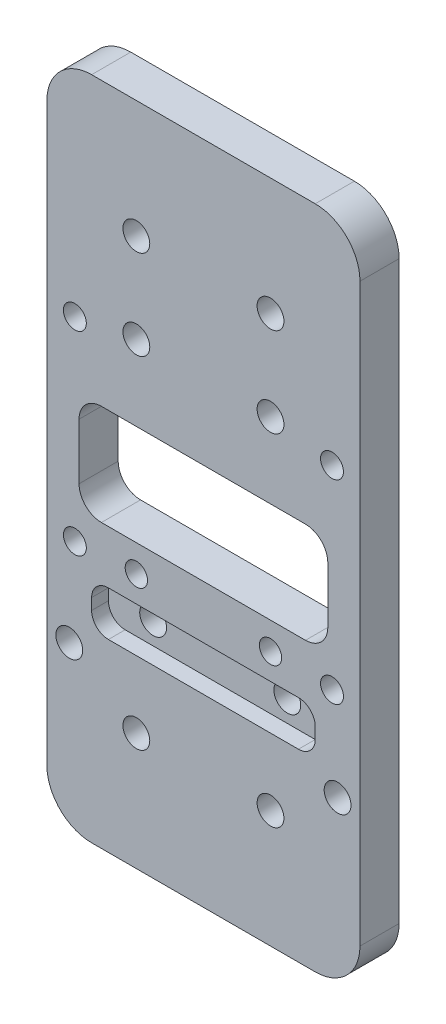
from build123d import *

# Parameters (mm, degrees)
BOSS_EXTRU_1_DEPTH      = 3.5
ESQUISSE2_R             = 1.2
ESQUISSE2_R_2           = 1.025
ENL_V_MAT_EXTRU_1_DEPTH = 66.852107028
ENL_V_MAT_EXTRU_2_DEPTH = 66.852107028
ESQUISSE7_R             = 1
ENL_V_MAT_EXTRU_4_DEPTH = 66.852107028
ESQUISSE9_R             = 1.2
ENL_V_MAT_EXTRU_6_DEPTH = 66.852107028
ENL_V_MAT_EXTRU_7_DEPTH = 1.5


with BuildPart() as part:
    # Esquisse1 → Boss.-Extru.1 (new body)
    with BuildSketch(Plane.XY):
        with BuildLine():
            Line((4, 0), (24, 0))
            ThreePointArc((24, 0), (26.828427125, 1.171572875), (28, 4))
            Line((28, 4), (28, 55.5))
            ThreePointArc((28, 55.5), (26.828427125, 58.328427125), (24, 59.5))
            Line((24, 59.5), (4, 59.5))
            ThreePointArc((4, 59.5), (1.171572875, 58.328427125), (0, 55.5))
            Line((0, 55.5), (0, 4))
            ThreePointArc((0, 4), (1.171572875, 1.171572875), (4, 0))
        make_face()
    extrude(amount=BOSS_EXTRU_1_DEPTH)

    # Esquisse2 → Enlèv. mat.-Extru.1 (cut, through all)
    with BuildSketch(Plane.XY.offset(3.5)):
        with Locations((8, 10.5)):
            Circle(ESQUISSE2_R)
        with Locations((20, 10.5)):
            Circle(ESQUISSE2_R)
        with Locations((8, 18.5)):
            Circle(ESQUISSE2_R)
        with Locations((20, 18.5)):
            Circle(ESQUISSE2_R)
        with Locations((8, 49)):
            Circle(ESQUISSE2_R)
        with Locations((8, 41)):
            Circle(ESQUISSE2_R)
        with Locations((20, 49)):
            Circle(ESQUISSE2_R)
        with Locations((20, 41)):
            Circle(ESQUISSE2_R)
        with Locations((2.5, 40)):
            Circle(ESQUISSE2_R_2)
        with Locations((2.5, 22.6)):
            Circle(ESQUISSE2_R_2)
        with Locations((25.5, 40)):
            Circle(ESQUISSE2_R_2)
        with Locations((25.5, 22.6)):
            Circle(ESQUISSE2_R_2)
    extrude(amount=-ENL_V_MAT_EXTRU_1_DEPTH, mode=Mode.SUBTRACT)

    # Esquisse3 → Enlèv. mat.-Extru.2 (cut, through all)
    with BuildSketch(Plane.XY.offset(3.5)):
        with BuildLine():
            Line((4.875, 34.25), (23.125, 34.25))
            ThreePointArc((23.125, 34.25), (24.539213562, 33.664213562), (25.125, 32.25))
            Line((25.125, 32.25), (25.125, 27.25))
            ThreePointArc((25.125, 27.25), (24.539213562, 25.835786438), (23.125, 25.25))
            Line((23.125, 25.25), (4.875, 25.25))
            ThreePointArc((4.875, 25.25), (3.460786438, 25.835786438), (2.875, 27.25))
            Line((2.875, 27.25), (2.875, 32.25))
            ThreePointArc((2.875, 32.25), (3.460786438, 33.664213562), (4.875, 34.25))
        make_face()
    extrude(amount=-ENL_V_MAT_EXTRU_2_DEPTH, mode=Mode.SUBTRACT)

    # Esquisse7 → Enlèv. mat.-Extru.4 (cut, through all)
    with BuildSketch(Plane.XY.offset(3.5)):
        with Locations((8, 22.82)):
            Circle(ESQUISSE7_R)
        with Locations((20, 22.82)):
            Circle(ESQUISSE7_R)
    extrude(amount=-ENL_V_MAT_EXTRU_4_DEPTH, mode=Mode.SUBTRACT)

    # Esquisse9 → Enlèv. mat.-Extru.6 (cut, through all)
    with BuildSketch(Plane.XY.offset(3.5)):
        with Locations((2, 14.5)):
            Circle(ESQUISSE9_R)
        with Locations((26, 14.5)):
            Circle(ESQUISSE9_R)
    extrude(amount=-ENL_V_MAT_EXTRU_6_DEPTH, mode=Mode.SUBTRACT)

    # Esquisse10 → Enlèv. mat.-Extru.7 (cut)
    with BuildSketch(Plane.XY.offset(3.5)):
        with BuildLine():
            Line((5.5, 20.5), (22.5, 20.5))
            ThreePointArc((22.5, 20.5), (23.560660172, 20.060660172), (24, 19))
            Line((24, 19), (24, 18))
            ThreePointArc((24, 18), (23.560660172, 16.939339828), (22.5, 16.5))
            Line((22.5, 16.5), (5.5, 16.5))
            ThreePointArc((5.5, 16.5), (4.439339828, 16.939339828), (4, 18))
            Line((4, 18), (4, 19))
            ThreePointArc((4, 19), (4.439339828, 20.060660172), (5.5, 20.5))
        make_face()
    extrude(amount=-ENL_V_MAT_EXTRU_7_DEPTH, mode=Mode.SUBTRACT)


solid = part.part
